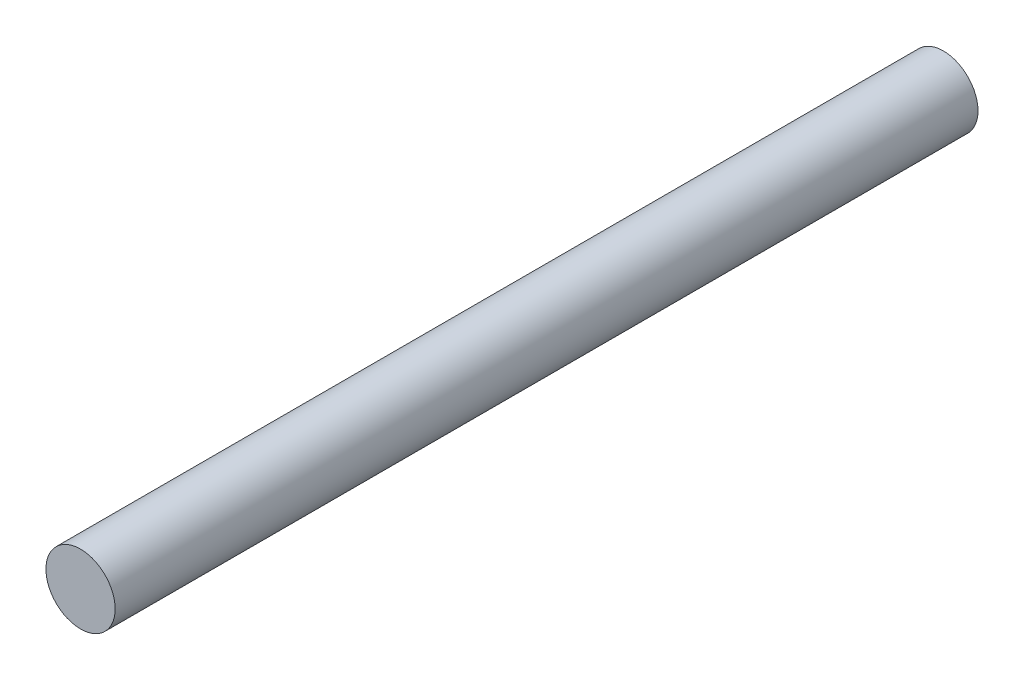
from build123d import *

# Parameters (mm, degrees)
ESQUISSE1_R        = 22.86
BOSS_EXTRU_1_DEPTH = 285


with BuildPart() as part:
    # Esquisse1 → Boss.-Extru.1 (new, symmetric)
    with BuildSketch(Plane.XY):
        Circle(ESQUISSE1_R)
    extrude(amount=BOSS_EXTRU_1_DEPTH, both=True)


solid = part.part
